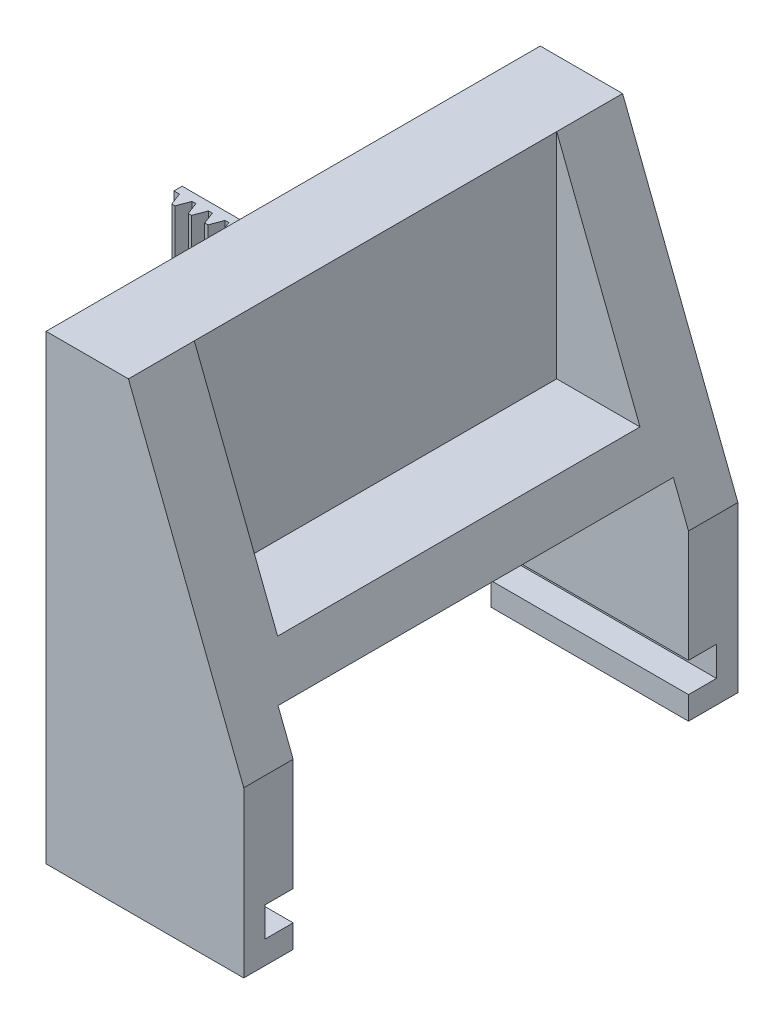
from build123d import *

# Parameters (mm, degrees)
BOSS_EXTRUDE1_DEPTH = 30
SKETCH4_W           = 24
SKETCH4_H           = 14
CUT_EXTRUDE2_DEPTH  = 25
SKETCH5_W           = 1.7
SKETCH5_H           = 1.8
CUT_EXTRUDE3_DEPTH  = 15
CUT_EXTRUDE4_DEPTH  = 11
BOSS_EXTRUDE2_DEPTH = 4


with BuildPart() as part:
    # Sketch1 → Boss-Extrude1 (new body)
    with BuildSketch(Plane.XY):
        Polygon((0, 0), (0, -28), (12, -28), (12, -18), (5, 0), align=None)
    extrude(amount=-BOSS_EXTRUDE1_DEPTH)

    # Sketch4 → Cut-Extrude2 (cut)
    with BuildSketch(Plane.ZY):
        with Locations((-15, -22.638599401)):
            Rectangle(SKETCH4_W, SKETCH4_H)
    extrude(amount=-CUT_EXTRUDE2_DEPTH, mode=Mode.SUBTRACT)

    # Sketch5 → Cut-Extrude3 (cut)
    with BuildSketch(Plane.ZY):
        with Locations((-2.15, -25.7)):
            Rectangle(SKETCH5_W, SKETCH5_H)
    cut_extrude3 = extrude(amount=-CUT_EXTRUDE3_DEPTH, mode=Mode.SUBTRACT)

    # Mirror1: Cut-Extrude3 across plane
    add(cut_extrude3.mirror(Plane.XY.offset(-15)), mode=Mode.SUBTRACT)

    # Sketch6 → Cut-Extrude4 (cut, symmetric)
    with BuildSketch(Plane.XY.offset(-15)):
        Polygon((5, 0), (5, -13), (10.055555556, -13), align=None)
    extrude(amount=CUT_EXTRUDE4_DEPTH, both=True, mode=Mode.SUBTRACT)

    # Sketch7 → Boss-Extrude2 (add)
    with BuildSketch(Plane(origin=(0, -15, 0), x_dir=(1, 0, 0), z_dir=(0, 1, 0))):
        Polygon((0, 22.760856069), (-14.5, 22.760856069), (-14.5, 22.260856069), (-14.164444468, 22.260856069), (-13.881153369, 21.511888257), (-13.681153369, 21.511888257), (-13.4, 22.260856069), (-13.164444468, 22.260856069), (-12.881153369, 21.511888257), (-12.681153369, 21.511888257), (-12.4, 22.260856069), (-12.164444468, 22.260856069), (-11.881153369, 21.511888257), (-11.681153369, 21.511888257), (-11.4, 22.260856069), (-11.164444468, 22.260856069), (-10.881153369, 21.511888257), (-10.681153369, 21.511888257), (-10.4, 22.260856069), (-10.164444468, 22.260856069), (-9.881153369, 21.511888257), (-9.681153369, 21.511888257), (-9.4, 22.260856069), (-9.164444468, 22.260856069), (-8.881153369, 21.511888257), (-8.681153369, 21.511888257), (-8.4, 22.260856069), (-8.164444468, 22.260856069), (-7.881153369, 21.511888257), (-7.681153369, 21.511888257), (-7.4, 22.260856069), (-7.164444468, 22.260856069), (-6.881153369, 21.511888257), (-6.681153369, 21.511888257), (-6.4, 22.260856069), (-6.164444468, 22.260856069), (-5.881153369, 21.511888257), (-5.681153369, 21.511888257), (-5.4, 22.260856069), (-5.164444468, 22.260856069), (-4.881153369, 21.511888257), (-4.681153369, 21.511888257), (-4.4, 22.260856069), (-4.164444468, 22.260856069), (-3.881153369, 21.511888257), (-3.681153369, 21.511888257), (-3.4, 22.260856069), (-3.164444468, 22.260856069), (-2.881153369, 21.511888257), (-2.681153369, 21.511888257), (-2.4, 22.260856069), (-2.164444468, 22.260856069), (-1.881153369, 21.511888257), (-1.681153369, 21.511888257), (-1.4, 22.260856069), (-1.164444468, 22.260856069), (-0.881153369, 21.511888257), (-0.681153369, 21.511888257), (-0.4, 22.260856069), (0, 22.260856069), align=None)
    extrude(amount=BOSS_EXTRUDE2_DEPTH)


solid = part.part
